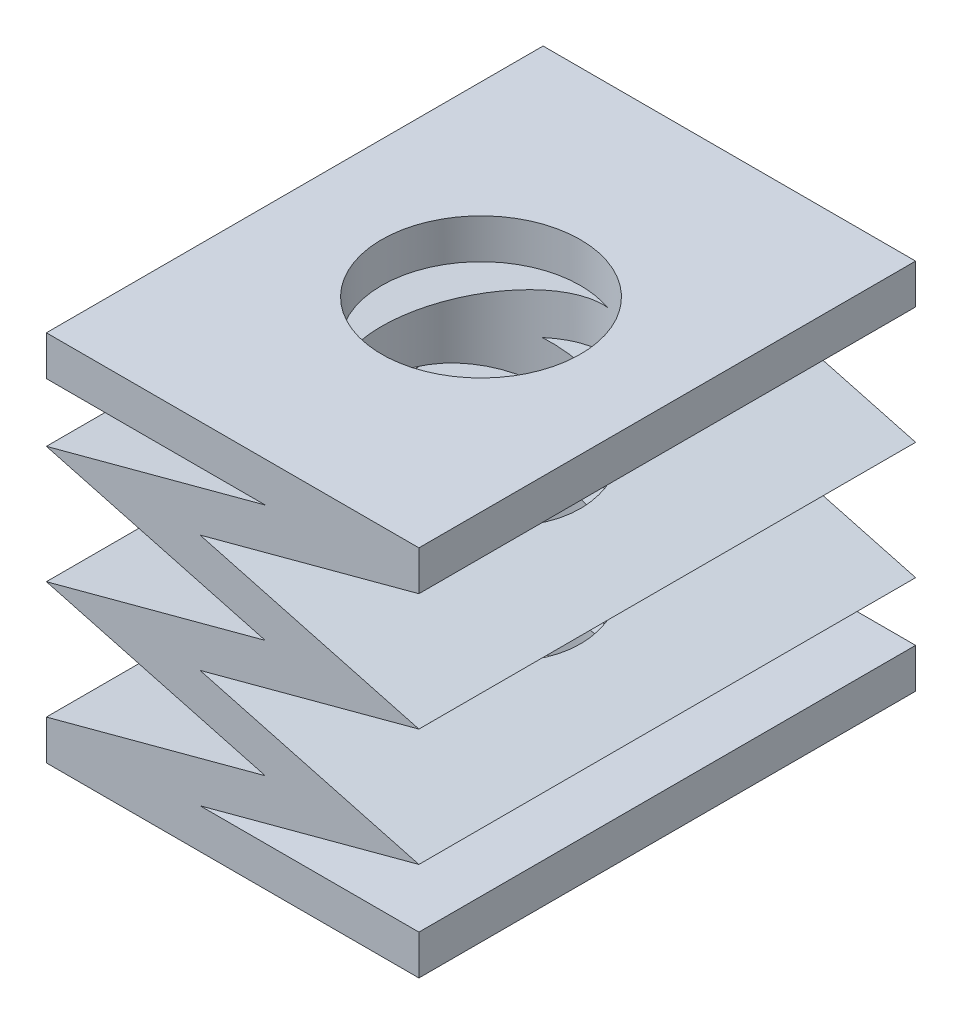
from build123d import *

# Parameters (mm, degrees)
BOSS_EXTRUDE3_DEPTH = 10
SKETCH4_R           = 2
CUT_EXTRUDE3_DEPTH  = 15.577379737


with BuildPart() as part:
    # Sketch3 → Boss-Extrude3 (new body)
    with BuildSketch(Plane.XY):
        Polygon((3.09302731, 0), (7.5, 1.18), (3.09302731, 2.36), (7.5, 3.54), (3.09302731, 4.72), (7.5, 5.9), (7.5, 6.7), (0, 6.7), (0, 5.9), (4.40697269, 5.9), (0, 4.72), (4.40697269, 3.54), (0, 2.36), (4.40697269, 1.18), (0, 0), (0, -0.8), (7.5, -0.8), (7.5, 0), align=None)
    extrude(amount=BOSS_EXTRUDE3_DEPTH)

    # Sketch4 → Cut-Extrude3 (cut, through all)
    with BuildSketch(Plane.XZ.offset(0.8)):
        with Locations((3.75, 5)):
            Circle(SKETCH4_R)
    extrude(amount=-CUT_EXTRUDE3_DEPTH, mode=Mode.SUBTRACT)


solid = part.part
